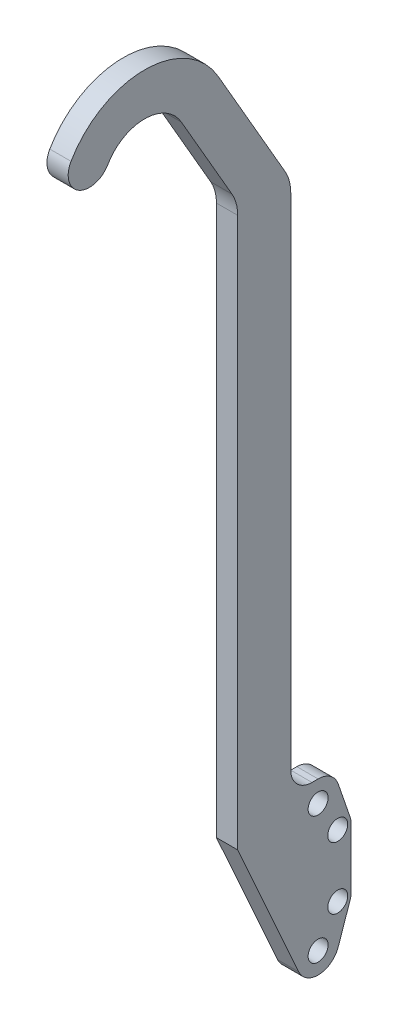
from build123d import *

# Parameters (mm, degrees)
BOSS_EXTRUDE1_DEPTH = 3.175
FILLET1_R           = 12.7
SKETCH2_R           = 2.9845
CUT_EXTRUDE1_DEPTH  = 248.533087061
FILLET2_R           = 6.35


with BuildPart() as part:
    # Sketch1 → Boss-Extrude1 (new, symmetric)
    with BuildSketch(Plane(origin=(0, 0, 0), x_dir=(0, 0, -1), z_dir=(1, 0, 0))):
        with BuildLine():
            Line((-8.731303996, -21.648910397), (-26.9875, 19.05))
            Line((-26.9875, 19.05), (-26.9875, 186.759204744))
            Line((-26.9875, 186.759204744), (-43.811945986, 215.9))
            ThreePointArc((-43.811945986, 215.9), (-54.810468614, 222.25), (-65.808991242, 215.9))
            ThreePointArc((-65.808991242, 215.9), (-74.483252556, 213.575738686), (-76.80751387, 222.25))
            ThreePointArc((-76.80751387, 222.25), (-54.810468614, 234.95), (-32.813423357, 222.25))
            Line((-32.813423357, 222.25), (-11.1125, 184.662898174))
            Line((-11.1125, 184.662898174), (-11.1125, 25.4))
            Line((-11.1125, 25.4), (-2.9375, 25.4))
            ThreePointArc((-2.9375, 25.4), (0.751942089, 24.218221848), (3.068123689, 21.112761283))
            Line((3.068123689, 21.112761283), (6.691014805, 10.56489959))
            ThreePointArc((6.691014805, 10.56489959), (6.852071397, 9.929208286), (6.90625, 9.275673789))
            Line((6.90625, 9.275673789), (6.90625, -9.275673789))
            ThreePointArc((6.90625, -9.275673789), (6.852071397, -9.929208286), (6.691014805, -10.56489959))
            Line((6.691014805, -10.56489959), (3.068123689, -21.112761283))
            ThreePointArc((3.068123689, -21.112761283), (-2.649262487, -25.393454827), (-8.731303996, -21.648910397))
        make_face()
    extrude(amount=BOSS_EXTRUDE1_DEPTH, both=True)

    # Fillet1
    fillet1_edges = [part.edges().sort_by_distance(p)[0] for p in [
        (0, 184.662898174, 11.1125),
        (0, 186.759204744, 26.9875),
    ]]
    fillet(fillet1_edges, radius=FILLET1_R)

    # Sketch2 → Cut-Extrude1 (cut, through all)
    with BuildSketch(Plane(origin=(3.175, 0, 0), x_dir=(0, 0, -1), z_dir=(1, 0, 0))):
        with Locations((-2.9375, 19.05)):
            Circle(SKETCH2_R)
        with Locations((2.9375, -9.275673789)):
            Circle(SKETCH2_R)
        with Locations((-2.9375, -19.05)):
            Circle(SKETCH2_R)
        with Locations((2.9375, 9.275673789)):
            Circle(SKETCH2_R)
    extrude(amount=-CUT_EXTRUDE1_DEPTH, mode=Mode.SUBTRACT)

    # Fillet2
    fillet2_edges = [part.edges().sort_by_distance(p)[0] for p in [
        (0, 25.4, 11.1125),
    ]]
    fillet(fillet2_edges, radius=FILLET2_R)


solid = part.part
